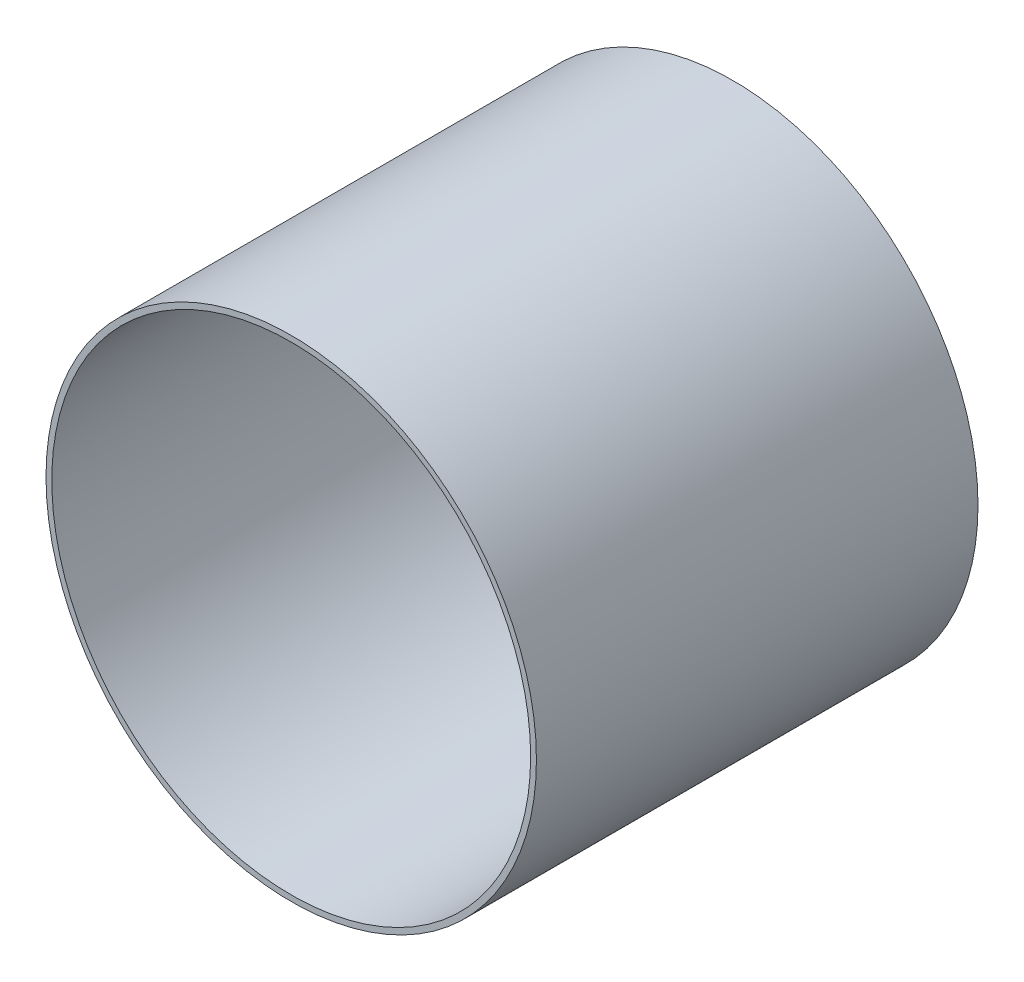
from build123d import *

# Parameters (mm, degrees)
SKETCH1_R           = 63.4746
SKETCH1_R_2         = 61.976
BOSS_EXTRUDE1_DEPTH = 57.15


with BuildPart() as part:
    # Sketch1 → Boss-Extrude1 (new, symmetric)
    with BuildSketch(Plane.XY):
        Circle(SKETCH1_R)
        Circle(SKETCH1_R_2, mode=Mode.SUBTRACT)
    extrude(amount=BOSS_EXTRUDE1_DEPTH, both=True)


solid = part.part
